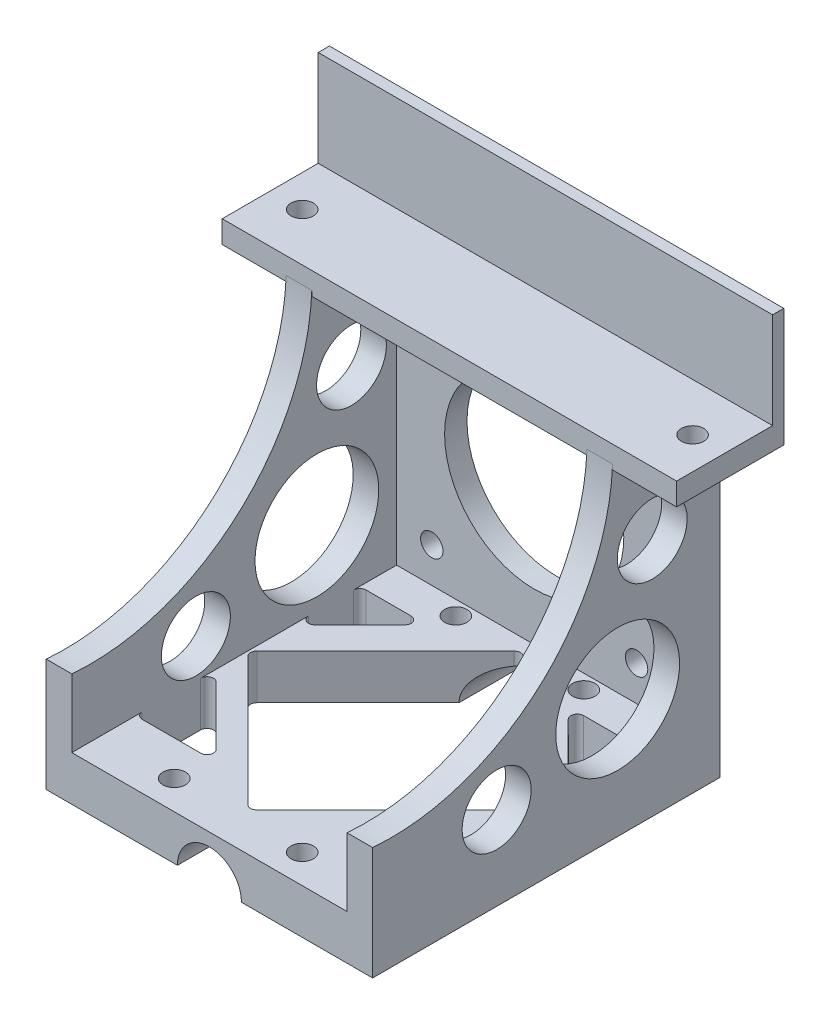
from build123d import *

# Parameters (mm, degrees)
SKETCH1_W                = 51
SKETCH1_H                = 53.5
BOSS_EXTRUDE1_DEPTH      = 54.25
SKETCH2_W                = 43
SKETCH2_H                = 43
CUT_EXTRUDE1_DEPTH       = 50.75
SKETCH3_W                = 43
SKETCH3_H                = 3.5
CUT_EXTRUDE2_DEPTH       = 37.5
CUT_EXTRUDE3_DEPTH       = 76
SKETCH5_R                = 9.673114497
SKETCH5_R_2              = 5.390775308
SKETCH5_R_3              = 5.456912487
CUT_EXTRUDE4_DEPTH       = 76
SKETCH6_R                = 14
SKETCH6_R_2              = 1.75
CUT_EXTRUDE5_DEPTH       = 76
SKETCH7_R                = 5
CUT_EXTRUDE6_DEPTH       = 76
CUT_EXTRUDE7_DEPTH       = 27
FILLET2_R                = 1
SKETCH12_R               = 1.75
CUT_EXTRUDE8_DEPTH       = 15
BOSS_EXTRUDE4_DEPTH      = 10
BOSS_EXTRUDE4_DEPTH_BACK = 61
SKETCH13_W               = 16.75
SKETCH13_H               = 3.5
SKETCH14_W               = 71
SKETCH14_H               = 1.75
BOSS_EXTRUDE5_DEPTH      = 15
SKETCH15_R               = 1.75
CUT_EXTRUDE9_DEPTH       = 10


with BuildPart() as part:
    # Sketch1 → Boss-Extrude1 (new body)
    with BuildSketch(Plane.XY):
        with Locations((-26.432354029, 2.021717979)):
            Rectangle(SKETCH1_W, SKETCH1_H)
    extrude(amount=BOSS_EXTRUDE1_DEPTH)

    # Sketch2 → Cut-Extrude1 (cut)
    with BuildSketch(Plane.XY.offset(54.25)):
        with Locations((-26.432354029, 3.771717979)):
            Rectangle(SKETCH2_W, SKETCH2_H)
    extrude(amount=-CUT_EXTRUDE1_DEPTH, mode=Mode.SUBTRACT)

    # Sketch3 → Cut-Extrude2 (cut)
    with BuildSketch(Plane.XY.offset(54.25)):
        with Locations((-26.432354029, 27.021717979)):
            Rectangle(SKETCH3_W, SKETCH3_H)
    extrude(amount=-CUT_EXTRUDE2_DEPTH, mode=Mode.SUBTRACT)

    # Sketch4 → Cut-Extrude3 (cut)
    with BuildSketch(Plane.ZY.offset(51.932354029)):
        with BuildLine():
            Line((16.75, 28.771717979), (54.25, 28.771717979))
            Line((54.25, 28.771717979), (54.25, -7.074674815))
            ThreePointArc((54.25, -7.074674815), (27.422353926, 2.398250742), (16.75, 28.771717979))
        make_face()
    extrude(amount=-CUT_EXTRUDE3_DEPTH, mode=Mode.SUBTRACT)

    # Sketch5 → Cut-Extrude4 (cut)
    with BuildSketch(Plane.ZY.offset(51.932354029)):
        with Locations(Location((15.954892055, -6.11697424, 0), (0, 0, 270))):
            Circle(SKETCH5_R)
        with Locations(Location((34.868290168, -11.652602956, 0), (0, 0, 270))):
            Circle(SKETCH5_R_2)
        with Locations(Location((10.551064023, 12.862324215, 0), (0, 0, 270))):
            Circle(SKETCH5_R_3)
    extrude(amount=-CUT_EXTRUDE4_DEPTH, mode=Mode.SUBTRACT)

    # Sketch6 → Cut-Extrude5 (cut)
    with BuildSketch(Plane.XY.offset(3.5)):
        with Locations((-26.432354029, 3.771717979)):
            Circle(SKETCH6_R)
        with Locations((-10.432354029, 19.771717979)):
            Circle(SKETCH6_R_2)
        with Locations((-42.432354029, 19.771717979)):
            Circle(SKETCH6_R_2)
        with Locations((-42.432354029, -12.228282021)):
            Circle(SKETCH6_R_2)
        with Locations((-10.432354029, -12.228282021)):
            Circle(SKETCH6_R_2)
    extrude(amount=-CUT_EXTRUDE5_DEPTH, mode=Mode.SUBTRACT)

    # Sketch7 → Cut-Extrude6 (cut)
    with BuildSketch(Plane(origin=(0, 0, 0), x_dir=(-1, 0, 0), z_dir=(0, 0, -1))):
        with Locations((26.432354029, -24.728282021)):
            Circle(SKETCH7_R)
    extrude(amount=-CUT_EXTRUDE6_DEPTH, mode=Mode.SUBTRACT)

    # Sketch8 → Cut-Extrude7 (cut)
    with BuildSketch(Plane.XZ.offset(24.728282021)):
        Polygon((-26.432354029, 48.25), (-4.932354029, 26.75), (-26.432354029, 5.25), (-47.932354029, 26.75), align=None)
        Polygon((-15.361286217, 44.25), (-4.932354029, 44.25), (-4.932354029, 33.821067812), align=None)
        Polygon((-4.932354029, 9.25), (-15.361286217, 9.25), (-4.932354029, 19.678932188), align=None)
        Polygon((-47.932354029, 9.25), (-37.503421841, 9.25), (-47.932354029, 19.678932188), align=None)
        Polygon((-47.932354029, 44.25), (-35.382101497, 44.25), (-47.932354029, 31.699747468), align=None)
    extrude(amount=-CUT_EXTRUDE7_DEPTH, mode=Mode.SUBTRACT)

    # Fillet2
    # the kernel refuses this fillet: 1 mm, written as the material it adds along each edge
    with BuildSketch(Plane(origin=(-47.932354029, -24.728282021, 31.699747468), x_dir=(0, 0, 1), z_dir=(0, 1, 0)), Plane(origin=(-4.932354029, -24.728282021, 19.678932188), x_dir=(0, 0, -1), z_dir=(0, 1, 0))) as fillet2_piece_1:
        with BuildLine():
            CenterArc((FILLET2_R * 2.41421356237, FILLET2_R), FILLET2_R, 135, 135)
            Line((FILLET2_R * 1.70710678119, FILLET2_R * 1.70710678119), (0, 0))
            Line((0, 0), (FILLET2_R * 2.41421356237, 0))
        make_face()
    extrude(amount=7)
    with BuildSketch(Plane(origin=(-4.932354029, -24.728282021, 33.821067812), x_dir=(0, 0, 1), z_dir=(0, 1, 0)), Plane(origin=(-47.932354029, -24.728282021, 19.678932188), x_dir=(0, 0, -1), z_dir=(0, 1, 0)), Plane(origin=(-15.361286217, -24.728282021, 9.25), x_dir=(1, 0, 0), z_dir=(0, 1, 0)), Plane(origin=(-37.503421841, -24.728282021, 9.25), x_dir=(-0.7071067811865486, 0, 0.7071067811865465), z_dir=(0, 1, 0)), Plane(origin=(-35.382101497, -24.728282021, 44.25), x_dir=(-1, 0, 0), z_dir=(0, 1, 0)), Plane(origin=(-15.361286217, -24.728282021, 44.25), x_dir=(0.7071067811865479, 0, -0.7071067811865472), z_dir=(0, 1, 0))) as fillet2_piece_2:
        with BuildLine():
            CenterArc((FILLET2_R * 2.41421356237, -FILLET2_R), FILLET2_R, 90, 135)
            Line((FILLET2_R * 1.70710678119, -FILLET2_R * 1.70710678119), (0, 0))
            Line((0, 0), (FILLET2_R * 2.41421356237, 0))
        make_face()
    extrude(amount=7)
    with BuildSketch(Plane(origin=(-26.432354029, -22.228282021, 5.25), x_dir=(0.7071067811865436, 0, 0.7071067811865516), z_dir=(0, 1, 0))) as fillet2_piece_3_section:
        with BuildLine():
            CenterArc((FILLET2_R, -FILLET2_R), FILLET2_R, 90, 90)
            Line((0, -FILLET2_R), (0, 0))
            Line((0, 0), (FILLET2_R, 0))
        make_face()
    fillet2_piece_3 = extrude(amount=4.5, mode=Mode.PRIVATE)
    fillet2_piece_3 = fillet2_piece_3 - Plane(origin=(-26.432354029, -24.728282021, 5.570701766), x_dir=(-1, 0, 0), z_dir=(0, 0, -1)) * Cylinder(5, 14, mode=Mode.PRIVATE)
    add(fillet2_piece_3)
    with BuildSketch(Plane(origin=(-4.932354029, -24.728282021, 9.25), x_dir=(0, 0, 1), z_dir=(0, 1, 0)), Plane(origin=(-47.932354029, -24.728282021, 26.75), x_dir=(0.7071067811865476, 0, -0.7071067811865476), z_dir=(0, 1, 0)), Plane(origin=(-47.932354029, -24.728282021, 44.25), x_dir=(0, 0, -1), z_dir=(0, 1, 0))) as fillet2_piece_4:
        with BuildLine():
            CenterArc((FILLET2_R, -FILLET2_R), FILLET2_R, 90, 90)
            Line((0, -FILLET2_R), (0, 0))
            Line((0, 0), (FILLET2_R, 0))
        make_face()
    extrude(amount=7)
    with BuildSketch(Plane(origin=(-47.932354029, -24.728282021, 9.25), x_dir=(0, 0, 1), z_dir=(0, 1, 0)), Plane(origin=(-4.932354029, -24.728282021, 26.75), x_dir=(-0.707106781186544, 0, -0.7071067811865511), z_dir=(0, 1, 0)), Plane(origin=(-4.932354029, -24.728282021, 44.25), x_dir=(0, 0, -1), z_dir=(0, 1, 0))) as fillet2_piece_5:
        with BuildLine():
            CenterArc((FILLET2_R, FILLET2_R), FILLET2_R, 180, 90)
            Line((0, FILLET2_R), (0, 0))
            Line((0, 0), (FILLET2_R, 0))
        make_face()
    extrude(amount=7)
    with BuildSketch(Plane(origin=(-26.432354029, -22.228282021, 48.25), x_dir=(0.7071067811865476, 0, -0.7071067811865476), z_dir=(0, 1, 0))) as fillet2_piece_6_section:
        with BuildLine():
            CenterArc((FILLET2_R, FILLET2_R), FILLET2_R, 180, 90)
            Line((0, FILLET2_R), (0, 0))
            Line((0, 0), (FILLET2_R, 0))
        make_face()
    fillet2_piece_6 = extrude(amount=4.5, mode=Mode.PRIVATE)
    fillet2_piece_6 = fillet2_piece_6 - Plane(origin=(-26.432354029, -24.728282021, 47.9292983), x_dir=(-1, 0, 0), z_dir=(0, 0, -1)) * Cylinder(5, 14, mode=Mode.PRIVATE)
    add(fillet2_piece_6)

    # Sketch12 → Cut-Extrude8 (cut)
    with BuildSketch(Plane.XZ.offset(24.728282021)):
        with Locations(Location((-16.432354029, 49.75, 0), (0, 0, 270))):
            Circle(SKETCH12_R)
        with Locations(Location((-36.432354029, 49.75, 0), (0, 0, 270))):
            Circle(SKETCH12_R)
        with Locations(Location((-16.432354029, 5.75, 0), (0, 0, 270))):
            Circle(SKETCH12_R)
        with Locations(Location((-36.432354029, 5.75, 0), (0, 0, 270))):
            Circle(SKETCH12_R)
    extrude(amount=-CUT_EXTRUDE8_DEPTH, mode=Mode.SUBTRACT)

    # Sketch13 → Boss-Extrude4 (add, two sides: drawn at the far end of the back side and taken through both)
    with BuildSketch(Plane.ZY.offset(51.932354029).offset(-BOSS_EXTRUDE4_DEPTH_BACK)):
        with Locations((8.375, 27.021717979)):
            Rectangle(SKETCH13_W, SKETCH13_H)
    extrude(amount=BOSS_EXTRUDE4_DEPTH + BOSS_EXTRUDE4_DEPTH_BACK)

    # Sketch14 → Boss-Extrude5 (add)
    with BuildSketch(Plane(origin=(0, 28.771717979, 0), x_dir=(1, 0, 0), z_dir=(0, 1, 0))):
        with Locations((-26.432354029, -0.875)):
            Rectangle(SKETCH14_W, SKETCH14_H)
    extrude(amount=BOSS_EXTRUDE5_DEPTH)

    # Sketch15 → Cut-Extrude9 (cut)
    with BuildSketch(Plane.XZ.offset(-25.271717979)):
        with Locations((-56.932354029, 9.25)):
            Circle(SKETCH15_R)
        with Locations((4.067645971, 9.25)):
            Circle(SKETCH15_R)
    extrude(amount=-CUT_EXTRUDE9_DEPTH, mode=Mode.SUBTRACT)


solid = part.part
